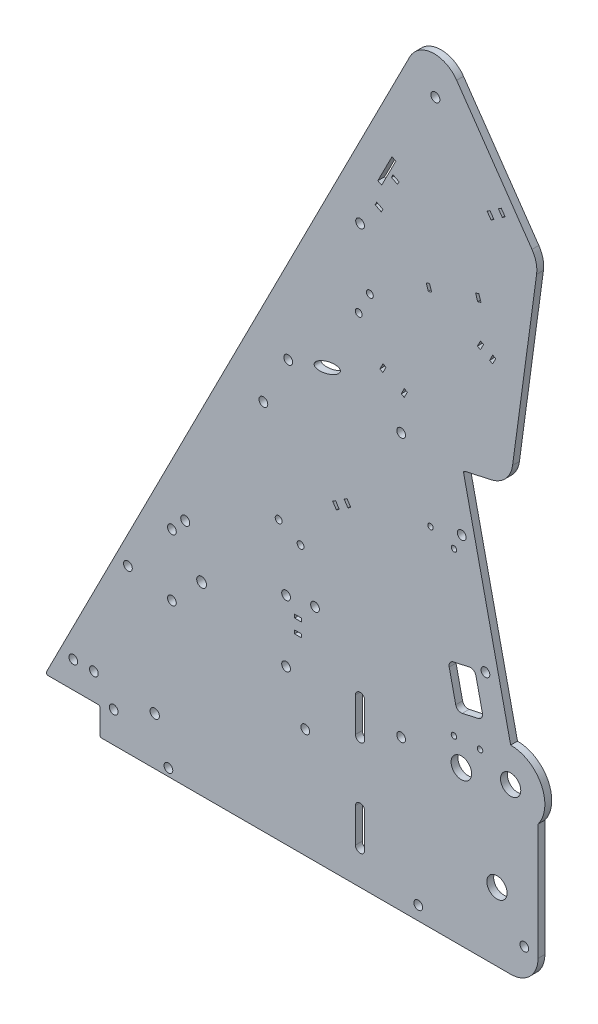
from build123d import *

# Parameters (mm, degrees)
BOSS_EXTRUDE1_DEPTH     = 3.175
SKETCH2_R               = 2.0955
SKETCH2_R_2             = 2.286
SKETCH2_R_3             = 2.032
SKETCH2_R_4             = 4.699
CUT_EXTRUDE1_DEPTH      = 421.976111717
SKETCH7_R               = 2.159
CUT_EXTRUDE2_DEPTH      = 421.976111717
CUT_EXTRUDE3_REACH      = 422.976
SKETCH10_R              = 2.032
FILLET1_R               = 12.7
FILLET2_R               = 0.79375
SKETCH12_R              = 2.032
CUT_EXTRUDE5_DEPTH      = 411.989226146
SKETCH13_R              = 2.032
SKETCH13_R_2            = 1.6
SKETCH13_RX             = 6.35
SKETCH13_RY             = 2.38125
SKETCH13_W              = 3.175
SKETCH13_H              = 1.5875
CUT_EXTRUDE6_DEPTH      = 411.989226146
CUT_EXTRUDE7_DEPTH      = 411.989226285
CUT_EXTRUDE7_DEPTH_BACK = 411.989226285
SKETCH14_R              = 1.27
SKETCH14_R_2            = 2.032
FILLET3_R               = 2.54
SKETCH15_R              = 4.7625
CUT_EXTRUDE8_DEPTH      = 411.989226285


with BuildPart() as part:
    # Sketch1 → Boss-Extrude1 (new body)
    with BuildSketch(Plane.XY):
        with BuildLine():
            Line((228.6, -12.7), (228.6, 53.975))
            ThreePointArc((228.6, 53.975), (230.099031657, 70.599515829), (215.9, 79.375))
            Line((215.9, 79.375), (193.909735224, 178.566674323))
            Line((193.909735224, 178.566674323), (215.607913982, 183.377044743))
            Line((215.607913982, 183.377044743), (228.6, 279.4))
            Line((228.6, 279.4), (178.754725958, 351.413083686))
            Line((178.754725958, 351.413083686), (0, 0))
            Line((0, 0), (25.4, 0))
            Line((25.4, 0), (25.4, -12.7))
            Line((25.4, -12.7), (228.6, -12.7))
        make_face()
    extrude(amount=BOSS_EXTRUDE1_DEPTH)

    # Sketch2 → Cut-Extrude1 (cut, through all)
    with BuildSketch(Plane.XY.offset(3.175)):
        with Locations((64.943150167, 94.057839899)):
            Circle(SKETCH2_R)
        with Locations((180.975, 322.164313376)):
            Circle(SKETCH2_R)
        with Locations((72.544547852, 73.173171402)):
            Circle(SKETCH2_R_2)
        with Locations((193.207821773, 152.394364194)):
            Circle(SKETCH2_R_3)
        with Locations((215.9, 63.5)):
            Circle(SKETCH2_R_4)
        with Locations((173.0375, -6.35)):
            Circle(SKETCH2_R_3)
        with Locations((204.202954161, 102.798527032)):
            Circle(SKETCH2_R_3)
        with Locations((209.55, 19.05)):
            Circle(SKETCH2_R_4)
        with Locations((165.1, 179.3875)):
            Circle(SKETCH2_R_3)
        with Locations((111.724047852, 87.460671402)):
            Circle(SKETCH2_R_3)
        with Locations((111.724047852, 58.885671402)):
            Circle(SKETCH2_R_3)
        with Locations((58.765047852, 58.885671402)):
            Circle(SKETCH2_R_3)
        with Locations((58.765047852, 87.460671402)):
            Circle(SKETCH2_R_3)
    extrude(amount=-CUT_EXTRUDE1_DEPTH, mode=Mode.SUBTRACT)

    # Sketch7 → Cut-Extrude2 (cut, through all)
    with BuildSketch(Plane.XY.offset(3.175)):
        with Locations((50.8, 9.525)):
            Circle(SKETCH7_R)
        with BuildLine():
            Line((143.891, 3.175), (143.891, 19.05))
            ThreePointArc((143.891, 19.05), (146.05, 21.209), (148.209, 19.05))
            Line((148.209, 19.05), (148.209, 3.175))
            ThreePointArc((148.209, 3.175), (146.05, 1.016), (143.891, 3.175))
        make_face()
        with BuildLine():
            Line((143.891, 47.625), (143.891, 63.5))
            ThreePointArc((143.891, 63.5), (146.05, 65.659), (148.209, 63.5))
            Line((148.209, 63.5), (148.209, 47.625))
            ThreePointArc((148.209, 47.625), (146.05, 45.466), (143.891, 47.625))
        make_face()
    extrude(amount=-CUT_EXTRUDE2_DEPTH, mode=Mode.SUBTRACT)

    # Sketch10 → Cut-Extrude3 (cut, up to next)
    with BuildSketch(Plane.XY.offset(3.175), mode=Mode.PRIVATE) as cut_extrude3_sk1:
        with Locations((120.65, 38.1)):
            Circle(SKETCH10_R)
    cut_extrude3_tool1 = extrude(cut_extrude3_sk1.sketch, amount=-CUT_EXTRUDE3_REACH, mode=Mode.PRIVATE) & part.part
    # Sketch10 → Cut-Extrude3 (cut, up to next)
    with BuildSketch(Plane.XY.offset(3.175), mode=Mode.PRIVATE) as cut_extrude3_sk2:
        with Locations((165.1, 57.15)):
            Circle(SKETCH10_R)
    cut_extrude3_tool2 = extrude(cut_extrude3_sk2.sketch, amount=-CUT_EXTRUDE3_REACH, mode=Mode.PRIVATE) & part.part
    # Sketch10 → Cut-Extrude3 (cut, up to next)
    with BuildSketch(Plane.XY.offset(3.175), mode=Mode.PRIVATE) as cut_extrude3_sk3:
        with Locations((13.046467246, 12.334704411)):
            Circle(SKETCH10_R)
    cut_extrude3_tool3 = extrude(cut_extrude3_sk3.sketch, amount=-CUT_EXTRUDE3_REACH, mode=Mode.PRIVATE) & part.part
    # Sketch10 → Cut-Extrude3 (cut, up to next)
    with BuildSketch(Plane.XY.offset(3.175), mode=Mode.PRIVATE) as cut_extrude3_sk4:
        with Locations((22.571467246, 12.334704411)):
            Circle(SKETCH10_R)
    cut_extrude3_tool4 = extrude(cut_extrude3_sk4.sketch, amount=-CUT_EXTRUDE3_REACH, mode=Mode.PRIVATE) & part.part
    # Sketch10 → Cut-Extrude3 (cut, up to next)
    with BuildSketch(Plane.XY.offset(3.175), mode=Mode.PRIVATE) as cut_extrude3_sk5:
        with Locations((38.360434174, 62.564025462)):
            Circle(SKETCH10_R)
    cut_extrude3_tool5 = extrude(cut_extrude3_sk5.sketch, amount=-CUT_EXTRUDE3_REACH, mode=Mode.PRIVATE) & part.part
    add(cut_extrude3_tool1.solids().sort_by_distance((120.65, 38.1, 3.175))[0], mode=Mode.SUBTRACT)
    add(cut_extrude3_tool2.solids().sort_by_distance((165.1, 57.15, 3.175))[0], mode=Mode.SUBTRACT)
    add(cut_extrude3_tool3.solids().sort_by_distance((13.046467, 12.334704, 3.175))[0], mode=Mode.SUBTRACT)
    add(cut_extrude3_tool4.solids().sort_by_distance((22.571467, 12.334704, 3.175))[0], mode=Mode.SUBTRACT)
    add(cut_extrude3_tool5.solids().sort_by_distance((38.360434, 62.564025, 3.175))[0], mode=Mode.SUBTRACT)

    # Fillet1
    fillet1_edges = [part.edges().sort_by_distance(p)[0] for p in [
        (228.6, -12.7, 1.5875),
        (178.754725958, 351.413083686, 1.5875),
        (215.607913982, 183.377044743, 1.5875),
        (228.6, 279.4, 1.5875),
    ]]
    fillet(fillet1_edges, radius=FILLET1_R)

    # Fillet2
    fillet2_edges = [part.edges().sort_by_distance(p)[0] for p in [
        (25.4, -12.7, 1.5875),
        (25.4, 0, 1.5875),
        (193.909735224, 178.566674323, 1.5875),
        (0, 0, 1.5875),
    ]]
    fillet(fillet2_edges, radius=FILLET2_R)

    # Sketch12 → Cut-Extrude5 (cut, through all)
    with BuildSketch(Plane.XY.offset(3.175)):
        with Locations((31.75, 1.5875)):
            Circle(SKETCH12_R)
        with Locations((173.0375, -6.35)):
            Circle(SKETCH12_R)
        with Locations((222.25, 1.5875)):
            Circle(SKETCH12_R)
        with Locations((57.15, -9.2075)):
            Circle(SKETCH12_R)
    extrude(amount=-CUT_EXTRUDE5_DEPTH, mode=Mode.SUBTRACT)

    # Sketch13 → Cut-Extrude6 (cut, through all)
    with BuildSketch(Plane.XY.offset(3.175)):
        with Locations((112.7125, 182.5625)):
            Circle(SKETCH13_R)
        with Locations((146.05, 254)):
            Circle(SKETCH13_R)
        with Locations((101.196445848, 159.923142748)):
            Circle(SKETCH13_R)
        with Locations((145.425401324, 217.737567137)):
            Circle(SKETCH13_R_2)
        with Locations((150.594024053, 227.898538502)):
            Circle(SKETCH13_R_2)
        with Locations((108.294003262, 116.150198589)):
            Circle(SKETCH13_R_2)
        with Locations((118.454974627, 110.981575859)):
            Circle(SKETCH13_R_2)
        with Locations(Location((130.826142263, 188.461522288), (0, 0, 18.038739462))):
            Ellipse(SKETCH13_RX, SKETCH13_RY)
        Polygon((178.26972852, 245.992253978), (176.758236028, 245.506922447), (177.728899089, 242.483937462), (179.240391581, 242.969268992), align=None)
        Polygon((160.847712251, 288.198438198), (154.283561384, 275.294004564), (156.066187939, 274.387228647), (162.630338806, 287.29166228), align=None)
        Polygon((200.609634347, 249.830809719), (202.12112684, 250.316141249), (201.150463779, 253.339126235), (199.638971286, 252.853794704), align=None)
        Polygon((160.590482388, 279.78010172), (163.420402045, 278.340594951), (164.140155429, 279.75555478), (161.310235773, 281.195061549), align=None)
        Polygon((153.789663007, 266.410402556), (153.069909623, 264.995442728), (155.899829279, 263.555935959), (156.619582664, 264.970895787), align=None)
        Polygon((203.330342332, 234.029927366), (201.915382504, 234.74968075), (200.475875735, 231.919761094), (201.890835563, 231.200007709), align=None)
        Polygon((206.135715047, 229.040747556), (207.550674876, 228.320994171), (208.990181645, 231.150913828), (207.575221816, 231.870667212), align=None)
        Polygon((211.540543439, 292.889033628), (210.235229039, 291.98553456), (212.042227175, 289.374905759), (213.347541575, 290.278404827), align=None)
        Polygon((206.319285837, 289.275037356), (205.013971437, 288.371538288), (206.820969573, 285.760909487), (208.126283974, 286.664408555), align=None)
        Polygon((133.35043444, 136.102010662), (135.081463368, 133.440401403), (136.412267998, 134.305915867), (134.681239069, 136.967525126), align=None)
        Polygon((155.228084113, 200.119678264), (156.643043941, 199.39992488), (158.08255071, 202.229844536), (156.667590882, 202.949597921), align=None)
        Polygon((165.132802911, 195.081404573), (166.547762739, 194.361651188), (167.987269508, 197.191570845), (166.57230968, 197.911324229), align=None)
        Polygon((140.404681887, 136.90245926), (138.673652958, 139.564068519), (140.004457588, 140.429582984), (141.735486516, 137.767973724), align=None)
        with Locations((117.248547852, 81.078921402)):
            Rectangle(SKETCH13_W, SKETCH13_H)
        with Locations((117.248547852, 74.728921402)):
            Rectangle(SKETCH13_W, SKETCH13_H)
    extrude(amount=-CUT_EXTRUDE6_DEPTH, mode=Mode.SUBTRACT)

    # Sketch14 → Cut-Extrude7 (cut, two sides: drawn at the far end of the back side and taken through both)
    with BuildSketch(Plane.XY.offset(3.175).offset(-CUT_EXTRUDE7_DEPTH_BACK)):
        with Locations((189.602197334, 69.980636704)):
            Circle(SKETCH14_R)
        with Locations((201.708862449, 70.509225118)):
            Circle(SKETCH14_R)
        with Locations((165.1, 57.15)):
            Circle(SKETCH14_R_2)
        with Locations((125.14977438, 89.522927623)):
            Circle(SKETCH14_R_2)
        with Locations((178.721644858, 148.532438598)):
            Circle(SKETCH14_R)
        with Locations((189.622629605, 145.09537131)):
            Circle(SKETCH14_R)
        Polygon((186.844411154, 98.950230697), (199.243370445, 101.699013794), (203.36654509, 83.100574858), (190.9675858, 80.351791761), align=None)
    extrude(amount=CUT_EXTRUDE7_DEPTH + CUT_EXTRUDE7_DEPTH_BACK, mode=Mode.SUBTRACT)

    # Fillet3
    fillet3_edges = [part.edges().sort_by_distance(p)[0] for p in [
        (199.243370445, 101.699013794, 1.5875),
        (186.844411154, 98.950230697, 1.5875),
        (190.9675858, 80.351791761, 1.5875),
        (203.36654509, 83.100574858, 1.5875),
    ]]
    fillet(fillet3_edges, radius=FILLET3_R)

    # Sketch15 → Cut-Extrude8 (cut, through all)
    with BuildSketch(Plane.XY.offset(3.175)):
        with Locations((193.04, 58.801)):
            Circle(SKETCH15_R)
    extrude(amount=-CUT_EXTRUDE8_DEPTH, mode=Mode.SUBTRACT)


solid = part.part
